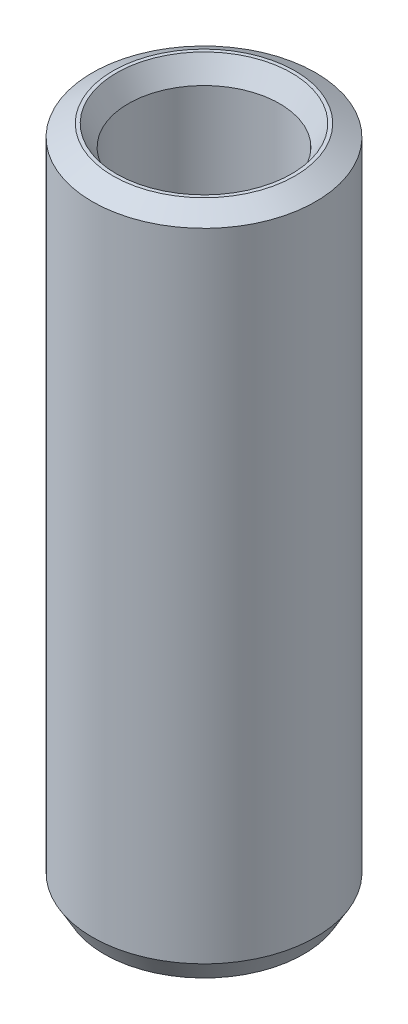
from build123d import *
from OCP.BRepFilletAPI import BRepFilletAPI_MakeChamfer

# Parameters (mm, degrees)
SKETCH1_R           = 35
BOSS_EXTRUDE1_DEPTH = 209.820098681
SKETCH2_R           = 23.701517318
CUT_EXTRUDE1_DEPTH  = 216.579390969
CHAMFER1_SIZE       = 3.734817
CHAMFER1_SIZE2      = 6.468892801


with BuildPart() as part:
    # Sketch1 → Boss-Extrude1 (new body)
    with BuildSketch(Plane(origin=(0, 0, 0), x_dir=(1, 0, 0), z_dir=(0, 1, 0))):
        Circle(SKETCH1_R)
    extrude(amount=BOSS_EXTRUDE1_DEPTH)

    # Sketch2 → Cut-Extrude1 (cut, through all)
    with BuildSketch(Plane(origin=(0, 0, 0), x_dir=(1, 0, 0), z_dir=(0, 1, 0))):
        Circle(SKETCH2_R)
    extrude(amount=CUT_EXTRUDE1_DEPTH, mode=Mode.SUBTRACT)

    # Chamfer1: one chamfer whose edges measure the first distance from different faces: ONE call of the kernel's chamfer builder (chamfer() names one face for all edges)
    chamfer1_edges_1 = [part.edges().sort_by_distance(p)[0] for p in [
        (-23.701517318, 209.820098681, 0),
    ]]
    chamfer1_side_1 = [part.faces().sort_by_distance(p)[0] for p in [
        (-34.010050506, 209.820098681, 0),
    ]]
    chamfer1_edges_2 = [part.edges().sort_by_distance(p)[0] for p in [
        (-23.701517318, 0, 0),
    ]]
    chamfer1_side_2 = [part.faces().sort_by_distance(p)[0] for p in [
        (-23.701517318, 104.91004934, 0),
    ]]
    chamfer1_edges_3 = [part.edges().sort_by_distance(p)[0] for p in [
        (-35, 0, 0),
    ]]
    chamfer1_side_3 = [part.faces().sort_by_distance(p)[0] for p in [
        (-34.010050506, 0, 0),
    ]]
    chamfer1_edges_4 = [part.edges().sort_by_distance(p)[0] for p in [
        (-35, 209.820098681, 0),
    ]]
    chamfer1_side_4 = [part.faces().sort_by_distance(p)[0] for p in [
        (-35, 104.91004934, 0),
    ]]
    chamfer1 = BRepFilletAPI_MakeChamfer(part.part.solid().wrapped)
    for e in chamfer1_edges_1:
        chamfer1.Add(CHAMFER1_SIZE, CHAMFER1_SIZE2, e.wrapped, chamfer1_side_1[0].wrapped)  # the first distance lies on this face
    for e in chamfer1_edges_2:
        chamfer1.Add(CHAMFER1_SIZE, CHAMFER1_SIZE2, e.wrapped, chamfer1_side_2[0].wrapped)  # the first distance lies on this face
    for e in chamfer1_edges_3:
        chamfer1.Add(CHAMFER1_SIZE, CHAMFER1_SIZE2, e.wrapped, chamfer1_side_3[0].wrapped)  # the first distance lies on this face
    for e in chamfer1_edges_4:
        chamfer1.Add(CHAMFER1_SIZE, CHAMFER1_SIZE2, e.wrapped, chamfer1_side_4[0].wrapped)  # the first distance lies on this face
    add(Compound.cast(chamfer1.Shape()), mode=Mode.REPLACE)


solid = part.part
